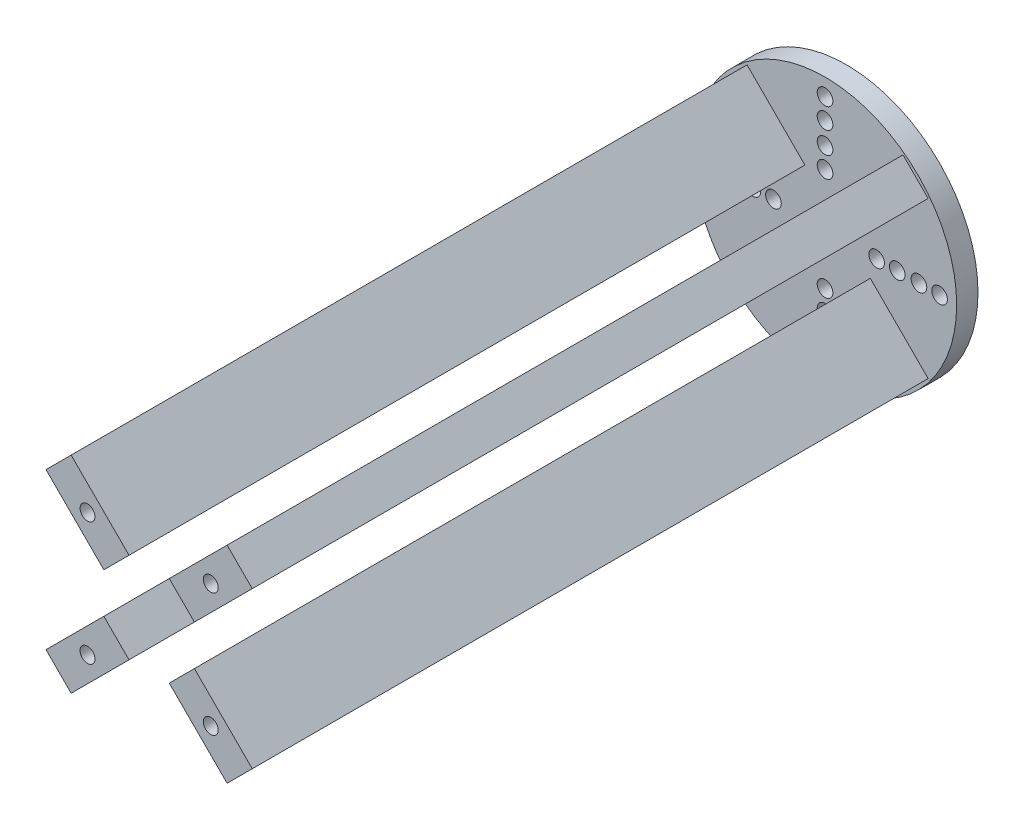
from build123d import *

# Parameters (mm, degrees)
SKIZZE2_R                       = 18.5
SKIZZE2_R_2                     = 1.1
AUFSATZ_LINEAR_AUSTRAGEN1_DEPTH = 3
AUFSATZ_LINEAR_AUSTRAGEN2_DEPTH = 95
SKIZZE5_R                       = 1.05
SCHNITT_LINEAR_AUSTRAGEN2_DEPTH = 13


with BuildPart() as part:
    # Skizze2 → Aufsatz-Linear austragen1 (new body)
    with BuildSketch(Plane.XY):
        Circle(SKIZZE2_R)
        with Locations((16.1, 0)):
            Circle(SKIZZE2_R_2, mode=Mode.SUBTRACT)
        with Locations((13.2, 0)):
            Circle(SKIZZE2_R_2, mode=Mode.SUBTRACT)
        with Locations((10.15, 0)):
            Circle(SKIZZE2_R_2, mode=Mode.SUBTRACT)
        with Locations((7.25, 0)):
            Circle(SKIZZE2_R_2, mode=Mode.SUBTRACT)
        with Locations((0, 7.25)):
            Circle(SKIZZE2_R_2, mode=Mode.SUBTRACT)
        with Locations((0, 10.15)):
            Circle(SKIZZE2_R_2, mode=Mode.SUBTRACT)
        with Locations((0, 13.2)):
            Circle(SKIZZE2_R_2, mode=Mode.SUBTRACT)
        with Locations((0, 16.1)):
            Circle(SKIZZE2_R_2, mode=Mode.SUBTRACT)
        with Locations((0, -16.1)):
            Circle(SKIZZE2_R_2, mode=Mode.SUBTRACT)
        with Locations((0, -13.2)):
            Circle(SKIZZE2_R_2, mode=Mode.SUBTRACT)
        with Locations((0, -10.15)):
            Circle(SKIZZE2_R_2, mode=Mode.SUBTRACT)
        with Locations((0, -7.25)):
            Circle(SKIZZE2_R_2, mode=Mode.SUBTRACT)
        with Locations((-16.1, 0)):
            Circle(SKIZZE2_R_2, mode=Mode.SUBTRACT)
        with Locations((-7.25, 0)):
            Circle(SKIZZE2_R_2, mode=Mode.SUBTRACT)
        with Locations((-10.15, 0)):
            Circle(SKIZZE2_R_2, mode=Mode.SUBTRACT)
        with Locations((-13.2, 0)):
            Circle(SKIZZE2_R_2, mode=Mode.SUBTRACT)
    extrude(amount=AUFSATZ_LINEAR_AUSTRAGEN1_DEPTH)

    # Skizze4 → Aufsatz-Linear austragen2 (add)
    with BuildSketch(Plane.XY.offset(3)):
        Polygon((2.828427125, 6.363961031), (10.960155108, 14.495689014), (14.495689014, 10.960155108), (6.363961031, 2.828427125), align=None)
        Polygon((6.363961031, -2.828427125), (14.495689014, -10.960155108), (10.960155108, -14.495689014), (2.828427125, -6.363961031), align=None)
        Polygon((-2.828427125, -6.363961031), (-10.960155108, -14.495689014), (-14.495689014, -10.960155108), (-6.363961031, -2.828427125), align=None)
        Polygon((-6.363961031, 2.828427125), (-14.495689014, 10.960155108), (-10.960155108, 14.495689014), (-2.828427125, 6.363961031), align=None)
    extrude(amount=AUFSATZ_LINEAR_AUSTRAGEN2_DEPTH)

    # Skizze5 → Schnitt-Linear austragen2 (cut)
    with BuildSketch(Plane.XY.offset(98)):
        with Locations((-8.66205807, -8.66205807)):
            Circle(SKIZZE5_R)
        with Locations((-8.66205807, 8.66205807)):
            Circle(SKIZZE5_R)
        with Locations((8.66205807, 8.66205807)):
            Circle(SKIZZE5_R)
        with Locations((8.66205807, -8.66205807)):
            Circle(SKIZZE5_R)
    extrude(amount=-SCHNITT_LINEAR_AUSTRAGEN2_DEPTH, mode=Mode.SUBTRACT)


solid = part.part
